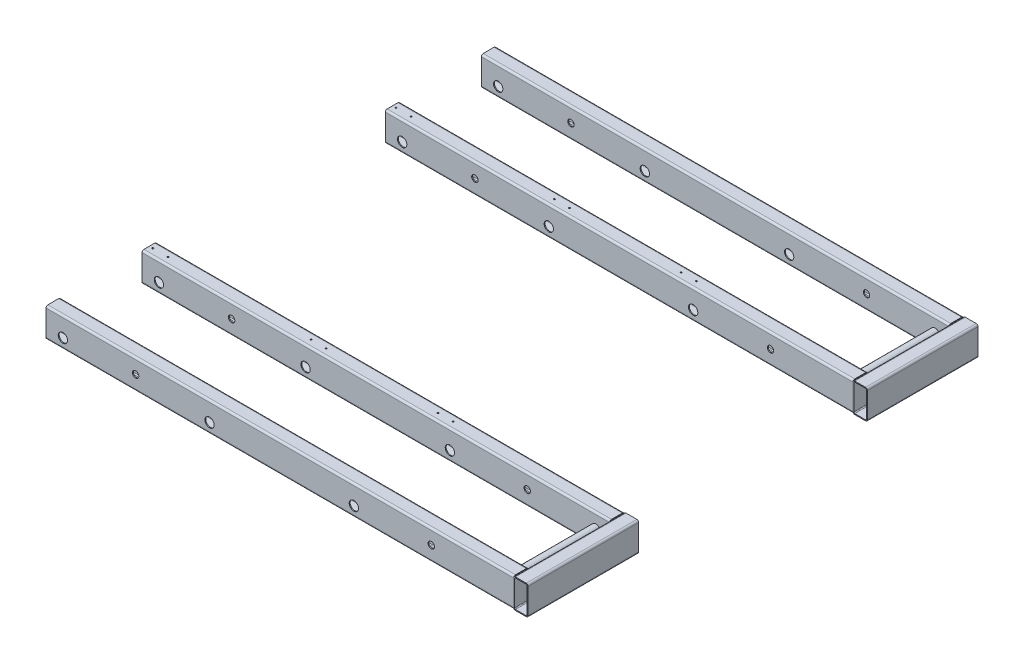
from build123d import *

# Parameters (mm, degrees)
RECTANGULAR_TUBE_2_50_X_25_X_1_6_1_DEPTH    = 816
RECTANGULAR_TUBE_2_50_X_25_X_1_6_1_2_DEPTH  = 816
RECTANGULAR_TUBE_2_50_X_25_X_1_6_1_3_DEPTH  = 816
RECTANGULAR_TUBE_2_50_X_25_X_1_6_1_4_DEPTH  = 816
SKETCH111_R                                 = 8
SKETCH111_R_2                               = 6.5
PIPE2_12_X_1_5_1_DEPTH                      = 165
SKETCH111_ON_SEGMENT_2_R                    = 8
SKETCH111_ON_SEGMENT_2_R_2                  = 6.5
PIPE2_12_X_1_5_1_2_DEPTH                    = 165
CUT_EXTRUDE4_OUTER_SMALLER_HOLES_DEPTH      = 875.424382094
CUT_EXTRUDE4_OUTER_SMALLER_HOLES_DEPTH_BACK = 875.424382094
SKETCH15_R                                  = 8
CUT_EXTRUDE8_START                          = -608
SKETCH15_3_R                                = 8
CUT_EXTRUDE8_CENTRE_LARGER_HOLES_DEPTH      = 443
CUT_EXTRUDE1_LINKAGE_HOLES_DEPTH            = 875.424382094
CUT_EXTRUDE1_LINKAGE_HOLES_DEPTH_BACK       = 875.424382094
SKETCH15_10_R                               = 5.5
TAP_DRILL_FOR_M3X0_5_TAP2_AT_2_COUNT        = 2
TAP_DRILL_FOR_M3X0_5_TAP2_AT_2_PITCH        = 418
TAP_DRILL_FOR_M3X0_5_TAP2_AT_3_COUNT        = 2
TAP_DRILL_FOR_M3X0_5_TAP2_AT_3_PITCH        = 418.807831827
TAP_DRILL_FOR_M3X0_5_TAP2_AT_4_COUNT        = 2
TAP_DRILL_FOR_M3X0_5_TAP2_AT_4_PITCH        = 498.706326409
TAP_DRILL_FOR_M3X0_5_TAP2_AT_5_COUNT        = 2
TAP_DRILL_FOR_M3X0_5_TAP2_AT_5_PITCH        = 644.068319358
TAP_DRILL_FOR_M3X0_5_TAP2_AT_6_COUNT        = 2
TAP_DRILL_FOR_M3X0_5_TAP2_AT_6_PITCH        = 513.349783286
TAP_DRILL_FOR_M3X0_5_TAP2_AT_7_COUNT        = 2
TAP_DRILL_FOR_M3X0_5_TAP2_AT_7_PITCH        = 664.06325
TAP_DRILL_FOR_M3X0_5_TAP2_AT_8_COUNT        = 2
TAP_DRILL_FOR_M3X0_5_TAP2_AT_8_PITCH        = 516
TAP_DRILL_FOR_M3X0_5_TAP2_AT_9_COUNT        = 2
TAP_DRILL_FOR_M3X0_5_TAP2_AT_9_PITCH        = 298
TAP_DRILL_FOR_M3X0_5_TAP2_AT_10_COUNT       = 2
TAP_DRILL_FOR_M3X0_5_TAP2_AT_10_PITCH       = 490
TAP_DRILL_FOR_M3X0_5_TAP2_AT_11_COUNT       = 2
TAP_DRILL_FOR_M3X0_5_TAP2_AT_11_PITCH       = 272
TAP_DRILL_FOR_M3X0_5_TAP2_AT_12_COUNT       = 2
TAP_DRILL_FOR_M3X0_5_TAP2_AT_12_PITCH       = 26
RECTANGULAR_TUBE_2_50_X_25_X_1_6_2_DEPTH    = 165
RECTANGULAR_TUBE_2_50_X_25_X_1_6_2_2_DEPTH  = 165
BODY_START                                  = 82.5
BODY_7_RUN_ON_DEPTH                         = 95
BODY_START_2                                = 76.25
BODY_7_RUN_ON_2_DEPTH                       = 101.25
BODY_8_RUN_ON_DEPTH                         = 95
BODY_8_RUN_ON_2_DEPTH                       = 101.25


with BuildPart() as part:
    # Sketch127 → Rectangular tube 2 50 X 25 X 1.6_1 (new body)
    with BuildSketch(Plane(origin=(-408, 0, 209), x_dir=(0, 0, -1), z_dir=(1, 0, 0))):
        with BuildLine():
            Line((-9.3, -25), (9.3, -25))
            ThreePointArc((9.3, -25), (11.5627417, -24.0627417), (12.5, -21.8))
            Line((12.5, -21.8), (12.5, 21.8))
            ThreePointArc((12.5, 21.8), (11.5627417, 24.0627417), (9.3, 25))
            Line((9.3, 25), (-9.3, 25))
            ThreePointArc((-9.3, 25), (-11.5627417, 24.0627417), (-12.5, 21.8))
            Line((-12.5, 21.8), (-12.5, -21.8))
            ThreePointArc((-12.5, -21.8), (-11.5627417, -24.0627417), (-9.3, -25))
        make_face()
        with BuildLine():
            Line((-9.3, -23.4), (9.3, -23.4))
            ThreePointArc((9.3, -23.4), (10.43137085, -22.93137085), (10.9, -21.8))
            Line((10.9, -21.8), (10.9, 21.8))
            ThreePointArc((10.9, 21.8), (10.43137085, 22.93137085), (9.3, 23.4))
            Line((9.3, 23.4), (-9.3, 23.4))
            ThreePointArc((-9.3, 23.4), (-10.43137085, 22.93137085), (-10.9, 21.8))
            Line((-10.9, 21.8), (-10.9, -21.8))
            ThreePointArc((-10.9, -21.8), (-10.43137085, -22.93137085), (-9.3, -23.4))
        make_face(mode=Mode.SUBTRACT)
    extrude(amount=RECTANGULAR_TUBE_2_50_X_25_X_1_6_1_DEPTH)


with BuildPart() as body_2:
    # Sketch127 on segment 2 (carried to segment 2) → Rectangular tube 2 50 X 25 X 1.6_1 2 (new body)
    with BuildSketch(Plane(origin=(-408, 0, -209), x_dir=(0, 0, -1), z_dir=(1, 0, 0))):
        with BuildLine():
            Line((-9.3, -25), (9.3, -25))
            ThreePointArc((9.3, -25), (11.5627417, -24.0627417), (12.5, -21.8))
            Line((12.5, -21.8), (12.5, 21.8))
            ThreePointArc((12.5, 21.8), (11.5627417, 24.0627417), (9.3, 25))
            Line((9.3, 25), (-9.3, 25))
            ThreePointArc((-9.3, 25), (-11.5627417, 24.0627417), (-12.5, 21.8))
            Line((-12.5, 21.8), (-12.5, -21.8))
            ThreePointArc((-12.5, -21.8), (-11.5627417, -24.0627417), (-9.3, -25))
        make_face()
        with BuildLine():
            Line((-9.3, -23.4), (9.3, -23.4))
            ThreePointArc((9.3, -23.4), (10.43137085, -22.93137085), (10.9, -21.8))
            Line((10.9, -21.8), (10.9, 21.8))
            ThreePointArc((10.9, 21.8), (10.43137085, 22.93137085), (9.3, 23.4))
            Line((9.3, 23.4), (-9.3, 23.4))
            ThreePointArc((-9.3, 23.4), (-10.43137085, 22.93137085), (-10.9, 21.8))
            Line((-10.9, 21.8), (-10.9, -21.8))
            ThreePointArc((-10.9, -21.8), (-10.43137085, -22.93137085), (-9.3, -23.4))
        make_face(mode=Mode.SUBTRACT)
    extrude(amount=RECTANGULAR_TUBE_2_50_X_25_X_1_6_1_2_DEPTH)


with BuildPart() as body_3:
    # Sketch127 on segment 3 (carried to segment 3) → Rectangular tube 2 50 X 25 X 1.6_1 3 (new body)
    with BuildSketch(Plane(origin=(-408, 0, -374), x_dir=(0, 0, -1), z_dir=(1, 0, 0))):
        with BuildLine():
            Line((-9.3, -25), (9.3, -25))
            ThreePointArc((9.3, -25), (11.5627417, -24.0627417), (12.5, -21.8))
            Line((12.5, -21.8), (12.5, 21.8))
            ThreePointArc((12.5, 21.8), (11.5627417, 24.0627417), (9.3, 25))
            Line((9.3, 25), (-9.3, 25))
            ThreePointArc((-9.3, 25), (-11.5627417, 24.0627417), (-12.5, 21.8))
            Line((-12.5, 21.8), (-12.5, -21.8))
            ThreePointArc((-12.5, -21.8), (-11.5627417, -24.0627417), (-9.3, -25))
        make_face()
        with BuildLine():
            Line((-9.3, -23.4), (9.3, -23.4))
            ThreePointArc((9.3, -23.4), (10.43137085, -22.93137085), (10.9, -21.8))
            Line((10.9, -21.8), (10.9, 21.8))
            ThreePointArc((10.9, 21.8), (10.43137085, 22.93137085), (9.3, 23.4))
            Line((9.3, 23.4), (-9.3, 23.4))
            ThreePointArc((-9.3, 23.4), (-10.43137085, 22.93137085), (-10.9, 21.8))
            Line((-10.9, 21.8), (-10.9, -21.8))
            ThreePointArc((-10.9, -21.8), (-10.43137085, -22.93137085), (-9.3, -23.4))
        make_face(mode=Mode.SUBTRACT)
    extrude(amount=RECTANGULAR_TUBE_2_50_X_25_X_1_6_1_3_DEPTH)


with BuildPart() as body_4:
    # Sketch127 on segment 4 (carried to segment 4) → Rectangular tube 2 50 X 25 X 1.6_1 4 (new body)
    with BuildSketch(Plane(origin=(-408, 0, 374), x_dir=(0, 0, -1), z_dir=(1, 0, 0))):
        with BuildLine():
            Line((-9.3, -25), (9.3, -25))
            ThreePointArc((9.3, -25), (11.5627417, -24.0627417), (12.5, -21.8))
            Line((12.5, -21.8), (12.5, 21.8))
            ThreePointArc((12.5, 21.8), (11.5627417, 24.0627417), (9.3, 25))
            Line((9.3, 25), (-9.3, 25))
            ThreePointArc((-9.3, 25), (-11.5627417, 24.0627417), (-12.5, 21.8))
            Line((-12.5, 21.8), (-12.5, -21.8))
            ThreePointArc((-12.5, -21.8), (-11.5627417, -24.0627417), (-9.3, -25))
        make_face()
        with BuildLine():
            Line((-9.3, -23.4), (9.3, -23.4))
            ThreePointArc((9.3, -23.4), (10.43137085, -22.93137085), (10.9, -21.8))
            Line((10.9, -21.8), (10.9, 21.8))
            ThreePointArc((10.9, 21.8), (10.43137085, 22.93137085), (9.3, 23.4))
            Line((9.3, 23.4), (-9.3, 23.4))
            ThreePointArc((-9.3, 23.4), (-10.43137085, 22.93137085), (-10.9, 21.8))
            Line((-10.9, 21.8), (-10.9, -21.8))
            ThreePointArc((-10.9, -21.8), (-10.43137085, -22.93137085), (-9.3, -23.4))
        make_face(mode=Mode.SUBTRACT)
    extrude(amount=RECTANGULAR_TUBE_2_50_X_25_X_1_6_1_4_DEPTH)


with BuildPart() as body_5:
    # Sketch111 → Pipe2 12 X 1.5_1 (new body)
    with BuildSketch(Plane(origin=(372, 0, -374), x_dir=(1, 0, 0), z_dir=(0, 0, 1))):
        Circle(SKETCH111_R)
        Circle(SKETCH111_R_2, mode=Mode.SUBTRACT)
    extrude(amount=PIPE2_12_X_1_5_1_DEPTH)


with BuildPart() as body_6:
    # Sketch111 on segment 2 (carried to segment 2) → Pipe2 12 X 1.5_1 2 (new body)
    with BuildSketch(Plane(origin=(372, 0, 209), x_dir=(1, 0, 0), z_dir=(0, 0, 1))):
        Circle(SKETCH111_ON_SEGMENT_2_R)
        Circle(SKETCH111_ON_SEGMENT_2_R_2, mode=Mode.SUBTRACT)
    extrude(amount=PIPE2_12_X_1_5_1_2_DEPTH)


with BuildPart() as cut_extrude4_outer_smaller_holes_tool:
    # Sketch15 → Cut-Extrude4 _Outer smaller holes (new, two sides: drawn at the far end of the back side and taken through both)
    with BuildSketch(Plane.XY.offset(386.5).offset(-CUT_EXTRUDE4_OUTER_SMALLER_HOLES_DEPTH_BACK)):
        with Locations(Location((-127, -8, 0), (0, 0, 180))):
            Circle(SKETCH15_R)
        with Locations(Location((121, -8, 0), (0, 0, 180))):
            Circle(SKETCH15_R)
        with Locations(Location((-379, -8, 0), (0, 0, 180))):
            Circle(SKETCH15_R)
    extrude(amount=CUT_EXTRUDE4_OUTER_SMALLER_HOLES_DEPTH + CUT_EXTRUDE4_OUTER_SMALLER_HOLES_DEPTH_BACK)


with BuildPart() as body_3_1:
    add(body_3.part)

    # Cut-Extrude4 _Outer smaller holes: cut by cut_extrude4_outer_smaller_holes_tool
    add(cut_extrude4_outer_smaller_holes_tool.part, mode=Mode.SUBTRACT)


with BuildPart() as body_4_1:
    add(body_4.part)

    # Cut-Extrude4 _Outer smaller holes: cut by cut_extrude4_outer_smaller_holes_tool
    add(cut_extrude4_outer_smaller_holes_tool.part, mode=Mode.SUBTRACT)


with BuildPart() as cut_extrude8_centre_larger_holes_tool:
    # Sketch15_3 → Cut-Extrude8 _Centre larger holes (new body)
    with BuildSketch(Plane.XY.offset(386.5).offset(CUT_EXTRUDE8_START)):
        with Locations(Location((-127, -8, 0), (0, 0, 180))):
            Circle(SKETCH15_3_R)
        with Locations(Location((121, -8, 0), (0, 0, 180))):
            Circle(SKETCH15_3_R)
        with Locations(Location((-379, -8, 0), (0, 0, 180))):
            Circle(SKETCH15_3_R)
    extrude(amount=CUT_EXTRUDE8_CENTRE_LARGER_HOLES_DEPTH)


with BuildPart() as part_1:
    add(part.part)

    # Cut-Extrude8 _Centre larger holes: cut by cut_extrude8_centre_larger_holes_tool
    add(cut_extrude8_centre_larger_holes_tool.part, mode=Mode.SUBTRACT)


with BuildPart() as body_2_1:
    add(body_2.part)

    # Cut-Extrude8 _Centre larger holes: cut by cut_extrude8_centre_larger_holes_tool
    add(cut_extrude8_centre_larger_holes_tool.part, mode=Mode.SUBTRACT)


with BuildPart() as cut_extrude1_linkage_holes_tool:
    # Sketch15_10 → Cut-Extrude1 _Linkage holes (new, two sides: drawn at the far end of the back side and taken through both)
    with BuildSketch(Plane.XY.offset(386.5).offset(-CUT_EXTRUDE1_LINKAGE_HOLES_DEPTH_BACK)):
        with Locations(Location((-254, 0, 0), (0, 0, 180))):
            Circle(SKETCH15_10_R)
        with Locations(Location((254, 0, 0), (0, 0, 180))):
            Circle(SKETCH15_10_R)
    extrude(amount=CUT_EXTRUDE1_LINKAGE_HOLES_DEPTH + CUT_EXTRUDE1_LINKAGE_HOLES_DEPTH_BACK)


with BuildPart() as part_2:
    add(part_1.part)

    # Cut-Extrude1 _Linkage holes: cut by cut_extrude1_linkage_holes_tool
    add(cut_extrude1_linkage_holes_tool.part, mode=Mode.SUBTRACT)


with BuildPart() as body_2_2:
    add(body_2_1.part)

    # Cut-Extrude1 _Linkage holes: cut by cut_extrude1_linkage_holes_tool
    add(cut_extrude1_linkage_holes_tool.part, mode=Mode.SUBTRACT)

    # Sketch26 → Tap Drill for M3x0.5 Tap2 (revolve, cut)
    with BuildSketch(Plane(origin=(-402, 25, -209), x_dir=(0, 0, 1), z_dir=(1, 0, 0))):
        Polygon((0, 0), (0, 2.351075774), (1.25, 1.6), (1.25, 0), align=None)
    tap_drill_for_m3x0_5_tap2 = revolve(axis=Axis((-402, 31.35, -209), (0, -1, 0)), mode=Mode.SUBTRACT)

    # Tap Drill for M3x0.5 Tap2 at 8: Tap Drill for M3x0.5 Tap2 ×2
    with Locations(*[(i * TAP_DRILL_FOR_M3X0_5_TAP2_AT_8_PITCH, 0, 0) for i in range(1, TAP_DRILL_FOR_M3X0_5_TAP2_AT_8_COUNT)]):
        add(tap_drill_for_m3x0_5_tap2, mode=Mode.SUBTRACT)

    # Tap Drill for M3x0.5 Tap2 at 9: Tap Drill for M3x0.5 Tap2 ×2
    with Locations(*[(i * TAP_DRILL_FOR_M3X0_5_TAP2_AT_9_PITCH, 0, 0) for i in range(1, TAP_DRILL_FOR_M3X0_5_TAP2_AT_9_COUNT)]):
        add(tap_drill_for_m3x0_5_tap2, mode=Mode.SUBTRACT)

    # Tap Drill for M3x0.5 Tap2 at 10: Tap Drill for M3x0.5 Tap2 ×2
    with Locations(*[(i * TAP_DRILL_FOR_M3X0_5_TAP2_AT_10_PITCH, 0, 0) for i in range(1, TAP_DRILL_FOR_M3X0_5_TAP2_AT_10_COUNT)]):
        add(tap_drill_for_m3x0_5_tap2, mode=Mode.SUBTRACT)

    # Tap Drill for M3x0.5 Tap2 at 11: Tap Drill for M3x0.5 Tap2 ×2
    with Locations(*[(i * TAP_DRILL_FOR_M3X0_5_TAP2_AT_11_PITCH, 0, 0) for i in range(1, TAP_DRILL_FOR_M3X0_5_TAP2_AT_11_COUNT)]):
        add(tap_drill_for_m3x0_5_tap2, mode=Mode.SUBTRACT)

    # Tap Drill for M3x0.5 Tap2 at 12: Tap Drill for M3x0.5 Tap2 ×2
    with Locations(*[(i * TAP_DRILL_FOR_M3X0_5_TAP2_AT_12_PITCH, 0, 0) for i in range(1, TAP_DRILL_FOR_M3X0_5_TAP2_AT_12_COUNT)]):
        add(tap_drill_for_m3x0_5_tap2, mode=Mode.SUBTRACT)

    # Trim_Extend7 4
    split(bisect_by=Plane(origin=(397.1, 0, -297.75), x_dir=(0, -1, 0), z_dir=(-1, 0, 0)), keep=Keep.TOP)

    # Trim_Extend7 7
    split(bisect_by=Plane(origin=(395.5, 0, -297.75), x_dir=(0, -1, 0), z_dir=(-1, 0, 0)), keep=Keep.TOP)


with BuildPart() as body_3_2:
    add(body_3_1.part)

    # Cut-Extrude1 _Linkage holes: cut by cut_extrude1_linkage_holes_tool
    add(cut_extrude1_linkage_holes_tool.part, mode=Mode.SUBTRACT)

    # Trim_Extend6 3
    split(bisect_by=Plane(origin=(395.5, 0, -291.5), x_dir=(0, -1, 0), z_dir=(-1, 0, 0)), keep=Keep.TOP)


with BuildPart() as body_4_2:
    add(body_4_1.part)

    # Cut-Extrude1 _Linkage holes: cut by cut_extrude1_linkage_holes_tool
    add(cut_extrude1_linkage_holes_tool.part, mode=Mode.SUBTRACT)

    # Trim_Extend9 4
    split(bisect_by=Plane(origin=(397.1, 0, 285.25), x_dir=(0, -1, 0), z_dir=(-1, 0, 0)), keep=Keep.TOP)

    # Trim_Extend9 7
    split(bisect_by=Plane(origin=(395.5, 0, 285.25), x_dir=(0, -1, 0), z_dir=(-1, 0, 0)), keep=Keep.TOP)


with BuildPart() as part_3:
    add(part_2.part)

    # Tap Drill for M3x0.5 Tap2 at 2: Tap Drill for M3x0.5 Tap2 ×2
    with Locations(*[(0, 0, i * TAP_DRILL_FOR_M3X0_5_TAP2_AT_2_PITCH) for i in range(1, TAP_DRILL_FOR_M3X0_5_TAP2_AT_2_COUNT)]):
        add(tap_drill_for_m3x0_5_tap2, mode=Mode.SUBTRACT)

    # Tap Drill for M3x0.5 Tap2 at 3: Tap Drill for M3x0.5 Tap2 ×2
    with Locations(*[Vector(0.062080978492094215, 0, 0.9980711157575216) * (i * TAP_DRILL_FOR_M3X0_5_TAP2_AT_3_PITCH) for i in range(1, TAP_DRILL_FOR_M3X0_5_TAP2_AT_3_COUNT)]):
        add(tap_drill_for_m3x0_5_tap2, mode=Mode.SUBTRACT)

    # Tap Drill for M3x0.5 Tap2 at 4: Tap Drill for M3x0.5 Tap2 ×2
    with Locations(*[Vector(0.5454111680490765, 0, 0.8381686332518905) * (i * TAP_DRILL_FOR_M3X0_5_TAP2_AT_4_PITCH) for i in range(1, TAP_DRILL_FOR_M3X0_5_TAP2_AT_4_COUNT)]):
        add(tap_drill_for_m3x0_5_tap2, mode=Mode.SUBTRACT)

    # Tap Drill for M3x0.5 Tap2 at 5: Tap Drill for M3x0.5 Tap2 ×2
    with Locations(*[Vector(0.7607888562020929, 0, 0.6489994732499491) * (i * TAP_DRILL_FOR_M3X0_5_TAP2_AT_5_PITCH) for i in range(1, TAP_DRILL_FOR_M3X0_5_TAP2_AT_5_COUNT)]):
        add(tap_drill_for_m3x0_5_tap2, mode=Mode.SUBTRACT)

    # Tap Drill for M3x0.5 Tap2 at 6: Tap Drill for M3x0.5 Tap2 ×2
    with Locations(*[Vector(0.5805008781582635, 0, 0.8142596210407864) * (i * TAP_DRILL_FOR_M3X0_5_TAP2_AT_6_PITCH) for i in range(1, TAP_DRILL_FOR_M3X0_5_TAP2_AT_6_COUNT)]):
        add(tap_drill_for_m3x0_5_tap2, mode=Mode.SUBTRACT)

    # Tap Drill for M3x0.5 Tap2 at 7: Tap Drill for M3x0.5 Tap2 ×2
    with Locations(*[Vector(0.7770344165263309, 0, 0.6294581126124158) * (i * TAP_DRILL_FOR_M3X0_5_TAP2_AT_7_PITCH) for i in range(1, TAP_DRILL_FOR_M3X0_5_TAP2_AT_7_COUNT)]):
        add(tap_drill_for_m3x0_5_tap2, mode=Mode.SUBTRACT)

    # Trim_Extend8 3
    split(bisect_by=Plane(origin=(395.5, 0, 291.5), x_dir=(0, -1, 0), z_dir=(-1, 0, 0)), keep=Keep.TOP)


with BuildPart() as body_7:
    # Sketch128 → Rectangular tube 2 50 X 25 X 1.6_2 (new body)
    with BuildSketch(Plane(origin=(408, 0, -374), x_dir=(1, 0, 0), z_dir=(0, 0, 1))):
        with BuildLine():
            Line((-9.3, -25), (9.3, -25))
            ThreePointArc((9.3, -25), (11.5627417, -24.0627417), (12.5, -21.8))
            Line((12.5, -21.8), (12.5, 21.8))
            ThreePointArc((12.5, 21.8), (11.5627417, 24.0627417), (9.3, 25))
            Line((9.3, 25), (-9.3, 25))
            ThreePointArc((-9.3, 25), (-11.5627417, 24.0627417), (-12.5, 21.8))
            Line((-12.5, 21.8), (-12.5, -21.8))
            ThreePointArc((-12.5, -21.8), (-11.5627417, -24.0627417), (-9.3, -25))
        make_face()
        with BuildLine():
            Line((-9.3, -23.4), (9.3, -23.4))
            ThreePointArc((9.3, -23.4), (10.43137085, -22.93137085), (10.9, -21.8))
            Line((10.9, -21.8), (10.9, 21.8))
            ThreePointArc((10.9, 21.8), (10.43137085, 22.93137085), (9.3, 23.4))
            Line((9.3, 23.4), (-9.3, 23.4))
            ThreePointArc((-9.3, 23.4), (-10.43137085, 22.93137085), (-10.9, 21.8))
            Line((-10.9, 21.8), (-10.9, -21.8))
            ThreePointArc((-10.9, -21.8), (-10.43137085, -22.93137085), (-9.3, -23.4))
        make_face(mode=Mode.SUBTRACT)
    extrude(amount=RECTANGULAR_TUBE_2_50_X_25_X_1_6_2_DEPTH)

    # body 7 cut square before the run-on
    split(bisect_by=Plane(origin=(408, 0, -291.5), x_dir=(0, -1, 0), z_dir=(0, 0, 1)), keep=Keep.TOP)

    # Sketch128 → body 7 run on (add)
    with BuildSketch(Plane(origin=(408, 0, -374), x_dir=(1, 0, 0), z_dir=(0, 0, 1)).offset(BODY_START)):
        with BuildLine():
            Line((-9.3, -25), (9.3, -25))
            ThreePointArc((9.3, -25), (11.5627417, -24.0627417), (12.5, -21.8))
            Line((12.5, -21.8), (12.5, 21.8))
            ThreePointArc((12.5, 21.8), (11.5627417, 24.0627417), (9.3, 25))
            Line((9.3, 25), (-9.3, 25))
            ThreePointArc((-9.3, 25), (-11.5627417, 24.0627417), (-12.5, 21.8))
            Line((-12.5, 21.8), (-12.5, -21.8))
            ThreePointArc((-12.5, -21.8), (-11.5627417, -24.0627417), (-9.3, -25))
        make_face()
        with BuildLine():
            Line((-9.3, -23.4), (9.3, -23.4))
            ThreePointArc((9.3, -23.4), (10.43137085, -22.93137085), (10.9, -21.8))
            Line((10.9, -21.8), (10.9, 21.8))
            ThreePointArc((10.9, 21.8), (10.43137085, 22.93137085), (9.3, 23.4))
            Line((9.3, 23.4), (-9.3, 23.4))
            ThreePointArc((-9.3, 23.4), (-10.43137085, 22.93137085), (-10.9, 21.8))
            Line((-10.9, 21.8), (-10.9, -21.8))
            ThreePointArc((-10.9, -21.8), (-10.43137085, -22.93137085), (-9.3, -23.4))
        make_face(mode=Mode.SUBTRACT)
    extrude(amount=-BODY_7_RUN_ON_DEPTH)

    # body 7 cut square before the run-on
    split(bisect_by=Plane(origin=(408, 0, -297.75), x_dir=(0, 1, 0), z_dir=(0, 0, -1)), keep=Keep.TOP)

    # Sketch128 → body 7 run on 2 (add)
    with BuildSketch(Plane(origin=(408, 0, -374), x_dir=(1, 0, 0), z_dir=(0, 0, 1)).offset(BODY_START_2)):
        with BuildLine():
            Line((-9.3, -25), (9.3, -25))
            ThreePointArc((9.3, -25), (11.5627417, -24.0627417), (12.5, -21.8))
            Line((12.5, -21.8), (12.5, 21.8))
            ThreePointArc((12.5, 21.8), (11.5627417, 24.0627417), (9.3, 25))
            Line((9.3, 25), (-9.3, 25))
            ThreePointArc((-9.3, 25), (-11.5627417, 24.0627417), (-12.5, 21.8))
            Line((-12.5, 21.8), (-12.5, -21.8))
            ThreePointArc((-12.5, -21.8), (-11.5627417, -24.0627417), (-9.3, -25))
        make_face()
        with BuildLine():
            Line((-9.3, -23.4), (9.3, -23.4))
            ThreePointArc((9.3, -23.4), (10.43137085, -22.93137085), (10.9, -21.8))
            Line((10.9, -21.8), (10.9, 21.8))
            ThreePointArc((10.9, 21.8), (10.43137085, 22.93137085), (9.3, 23.4))
            Line((9.3, 23.4), (-9.3, 23.4))
            ThreePointArc((-9.3, 23.4), (-10.43137085, 22.93137085), (-10.9, 21.8))
            Line((-10.9, 21.8), (-10.9, -21.8))
            ThreePointArc((-10.9, -21.8), (-10.43137085, -22.93137085), (-9.3, -23.4))
        make_face(mode=Mode.SUBTRACT)
    extrude(amount=BODY_7_RUN_ON_2_DEPTH)


with BuildPart() as body_8:
    # Sketch128 on segment 2 (carried to segment 2) → Rectangular tube 2 50 X 25 X 1.6_2 2 (new body)
    with BuildSketch(Plane(origin=(408, 0, 209), x_dir=(1, 0, 0), z_dir=(0, 0, 1))):
        with BuildLine():
            Line((-9.3, -25), (9.3, -25))
            ThreePointArc((9.3, -25), (11.5627417, -24.0627417), (12.5, -21.8))
            Line((12.5, -21.8), (12.5, 21.8))
            ThreePointArc((12.5, 21.8), (11.5627417, 24.0627417), (9.3, 25))
            Line((9.3, 25), (-9.3, 25))
            ThreePointArc((-9.3, 25), (-11.5627417, 24.0627417), (-12.5, 21.8))
            Line((-12.5, 21.8), (-12.5, -21.8))
            ThreePointArc((-12.5, -21.8), (-11.5627417, -24.0627417), (-9.3, -25))
        make_face()
        with BuildLine():
            Line((-9.3, -23.4), (9.3, -23.4))
            ThreePointArc((9.3, -23.4), (10.43137085, -22.93137085), (10.9, -21.8))
            Line((10.9, -21.8), (10.9, 21.8))
            ThreePointArc((10.9, 21.8), (10.43137085, 22.93137085), (9.3, 23.4))
            Line((9.3, 23.4), (-9.3, 23.4))
            ThreePointArc((-9.3, 23.4), (-10.43137085, 22.93137085), (-10.9, 21.8))
            Line((-10.9, 21.8), (-10.9, -21.8))
            ThreePointArc((-10.9, -21.8), (-10.43137085, -22.93137085), (-9.3, -23.4))
        make_face(mode=Mode.SUBTRACT)
    extrude(amount=RECTANGULAR_TUBE_2_50_X_25_X_1_6_2_2_DEPTH)

    # body 8 cut square before the run-on
    split(bisect_by=Plane(origin=(408, 0, 291.5), x_dir=(0, -1, 0), z_dir=(0, 0, 1)), keep=Keep.TOP)

    # Sketch128 on segment 2 (carried to segment 2) → body 8 run on (add)
    with BuildSketch(Plane(origin=(408, 0, 209), x_dir=(1, 0, 0), z_dir=(0, 0, 1)).offset(BODY_START)):
        with BuildLine():
            Line((-9.3, -25), (9.3, -25))
            ThreePointArc((9.3, -25), (11.5627417, -24.0627417), (12.5, -21.8))
            Line((12.5, -21.8), (12.5, 21.8))
            ThreePointArc((12.5, 21.8), (11.5627417, 24.0627417), (9.3, 25))
            Line((9.3, 25), (-9.3, 25))
            ThreePointArc((-9.3, 25), (-11.5627417, 24.0627417), (-12.5, 21.8))
            Line((-12.5, 21.8), (-12.5, -21.8))
            ThreePointArc((-12.5, -21.8), (-11.5627417, -24.0627417), (-9.3, -25))
        make_face()
        with BuildLine():
            Line((-9.3, -23.4), (9.3, -23.4))
            ThreePointArc((9.3, -23.4), (10.43137085, -22.93137085), (10.9, -21.8))
            Line((10.9, -21.8), (10.9, 21.8))
            ThreePointArc((10.9, 21.8), (10.43137085, 22.93137085), (9.3, 23.4))
            Line((9.3, 23.4), (-9.3, 23.4))
            ThreePointArc((-9.3, 23.4), (-10.43137085, 22.93137085), (-10.9, 21.8))
            Line((-10.9, 21.8), (-10.9, -21.8))
            ThreePointArc((-10.9, -21.8), (-10.43137085, -22.93137085), (-9.3, -23.4))
        make_face(mode=Mode.SUBTRACT)
    extrude(amount=-BODY_8_RUN_ON_DEPTH)

    # body 8 cut square before the run-on
    split(bisect_by=Plane(origin=(408, 0, 285.25), x_dir=(0, 1, 0), z_dir=(0, 0, -1)), keep=Keep.TOP)

    # Sketch128 on segment 2 (carried to segment 2) → body 8 run on 2 (add)
    with BuildSketch(Plane(origin=(408, 0, 209), x_dir=(1, 0, 0), z_dir=(0, 0, 1)).offset(BODY_START_2)):
        with BuildLine():
            Line((-9.3, -25), (9.3, -25))
            ThreePointArc((9.3, -25), (11.5627417, -24.0627417), (12.5, -21.8))
            Line((12.5, -21.8), (12.5, 21.8))
            ThreePointArc((12.5, 21.8), (11.5627417, 24.0627417), (9.3, 25))
            Line((9.3, 25), (-9.3, 25))
            ThreePointArc((-9.3, 25), (-11.5627417, 24.0627417), (-12.5, 21.8))
            Line((-12.5, 21.8), (-12.5, -21.8))
            ThreePointArc((-12.5, -21.8), (-11.5627417, -24.0627417), (-9.3, -25))
        make_face()
        with BuildLine():
            Line((-9.3, -23.4), (9.3, -23.4))
            ThreePointArc((9.3, -23.4), (10.43137085, -22.93137085), (10.9, -21.8))
            Line((10.9, -21.8), (10.9, 21.8))
            ThreePointArc((10.9, 21.8), (10.43137085, 22.93137085), (9.3, 23.4))
            Line((9.3, 23.4), (-9.3, 23.4))
            ThreePointArc((-9.3, 23.4), (-10.43137085, 22.93137085), (-10.9, 21.8))
            Line((-10.9, 21.8), (-10.9, -21.8))
            ThreePointArc((-10.9, -21.8), (-10.43137085, -22.93137085), (-9.3, -23.4))
        make_face(mode=Mode.SUBTRACT)
    extrude(amount=BODY_8_RUN_ON_2_DEPTH)


solid = Compound([body_5.part, body_6.part, body_2_2.part, body_3_2.part, body_4_2.part, part_3.part, body_7.part, body_8.part])
